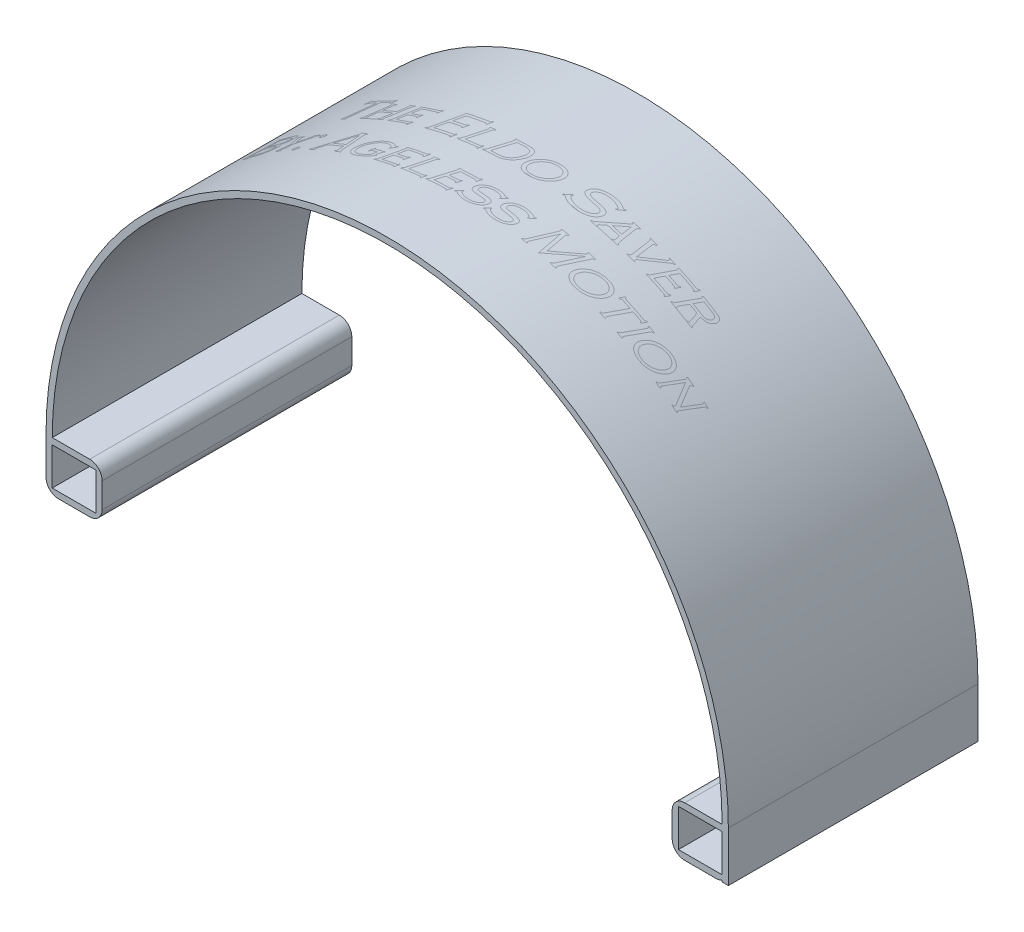
from build123d import *

# Parameters (mm, degrees)
BOSS_EXTRUDE2_DEPTH = 30
SKETCH4_W           = 1.5
SKETCH4_H           = 60
BOSS_EXTRUDE3_DEPTH = 12
SKETCH5_W           = 60
SKETCH5_H           = 1.5
BOSS_EXTRUDE4_DEPTH = 12
SKETCH6_W           = 1.5
SKETCH6_H           = 60
BOSS_EXTRUDE5_DEPTH = 10.5
BOSS_EXTRUDE6_REACH = 177.294
SKETCH9_W           = 60
SKETCH9_H           = 1.5
FILLET1_R           = 3
FILLET3_R           = 3


with BuildPart() as part:
    # Sketch1 → Boss-Extrude2 (new, symmetric)
    with BuildSketch(Plane.XY):
        with BuildLine():
            Line((-80.5, 0), (-82, 0))
            ThreePointArc((-82, 0), (0, 82), (82, 0))
            Line((82, 0), (80.5, 0))
            ThreePointArc((80.5, 0), (0, 80.5), (-80.5, 0))
        make_face()
    extrude(amount=BOSS_EXTRUDE2_DEPTH, both=True)

    # Sketch4 → Boss-Extrude3 (add)
    with BuildSketch(Plane.XZ):
        with Locations((-81.25, 0)):
            Rectangle(SKETCH4_W, SKETCH4_H)
        with Locations((81.25, 0)):
            Rectangle(SKETCH4_W, SKETCH4_H)
    boss_extrude3 = extrude(amount=BOSS_EXTRUDE3_DEPTH)

    # Sketch5 → Boss-Extrude4 (add)
    with BuildSketch(Plane.ZY.offset(-80.5)):
        with Locations((0, -11.25)):
            Rectangle(SKETCH5_W, SKETCH5_H)
    boss_extrude4 = extrude(amount=BOSS_EXTRUDE4_DEPTH)

    # Sketch6 → Boss-Extrude5 (add)
    with BuildSketch(Plane(origin=(0, -10.5, 0), x_dir=(1, 0, 0), z_dir=(0, 1, 0))):
        with Locations((69.25, 0)):
            Rectangle(SKETCH6_W, SKETCH6_H)
    boss_extrude5 = extrude(amount=BOSS_EXTRUDE5_DEPTH)

    # Sketch9 → Boss-Extrude6 (add, up to next)
    with BuildSketch(Plane(origin=(70, 0, 0), x_dir=(0, 0, -1), z_dir=(1, 0, 0)), mode=Mode.PRIVATE) as boss_extrude6_sk1:
        with Locations((0, -0.75)):
            Rectangle(SKETCH9_W, SKETCH9_H)
    boss_extrude6_tool1 = extrude(boss_extrude6_sk1.sketch, amount=BOSS_EXTRUDE6_REACH, mode=Mode.PRIVATE) - part.part
    boss_extrude6 = boss_extrude6_tool1.solids().sort_by_distance((70, -0.75, 0))[0]
    add(boss_extrude6)

    # Fillet1
    fillet1_edges = [part.edges().sort_by_distance(p)[0] for p in [
        (68.5, -12, 0),
        (82, -12, 0),
        (68.5, 0, 0),
    ]]
    fillet(fillet1_edges, radius=FILLET1_R)

    # Mirror11: Boss-Extrude3, Boss-Extrude4, Boss-Extrude5, Boss-Extrude6 across plane
    add(boss_extrude3.mirror(Plane(origin=(0, 0, 0), x_dir=(0, 0, 1), z_dir=(1, 0, 0))))
    add(boss_extrude4.mirror(Plane(origin=(0, 0, 0), x_dir=(0, 0, 1), z_dir=(1, 0, 0))))
    add(boss_extrude5.mirror(Plane(origin=(0, 0, 0), x_dir=(0, 0, 1), z_dir=(1, 0, 0))))
    add(boss_extrude6.mirror(Plane(origin=(0, 0, 0), x_dir=(0, 0, 1), z_dir=(1, 0, 0))))

    # Fillet3
    fillet3_edges = [part.edges().sort_by_distance(p)[0] for p in [
        (-82, -12, 0),
        (-68.5, -12, 0),
        (-68.5, 0, 0),
    ]]
    fillet(fillet3_edges, radius=FILLET3_R)


solid = part.part
